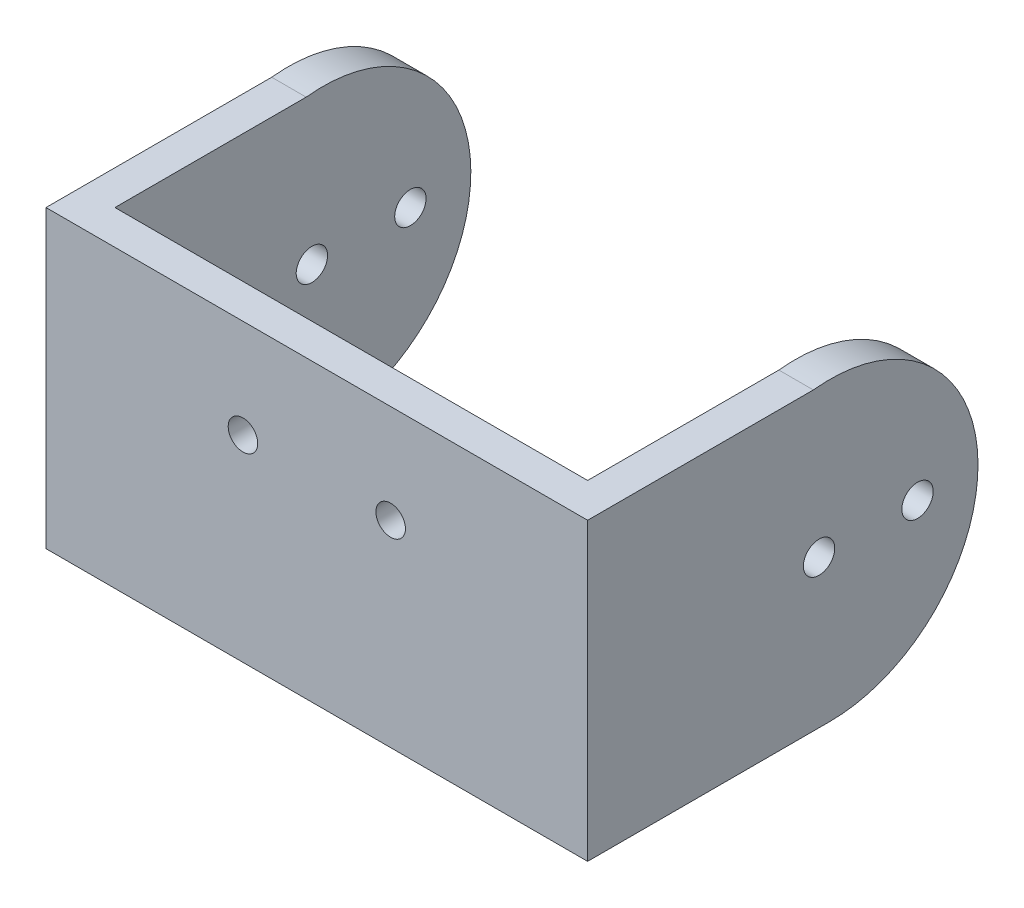
from build123d import *

# Parameters (mm, degrees)
SKETCH_1_W          = 55
SKETCH_1_H          = 30
EXTRUDE_1_DEPTH     = 3.5
SKETCH_2_R          = 1.592723526
EXTRUDE_2_DEPTH     = 3.5
SKETCH_3_R          = 1.5
CUT_EXTRUDE_1_DEPTH = 51.550726744


with BuildPart() as part:
    # 草图1 → 凸台-拉伸1 (new body)
    with BuildSketch(Plane.XY):
        Rectangle(SKETCH_1_W, SKETCH_1_H)
    extrude(amount=EXTRUDE_1_DEPTH)

    # 草图2 → 凸台-拉伸2 (add)
    with BuildSketch(Plane(origin=(27.5, 0, 0), x_dir=(0, 0, -1), z_dir=(1, 0, 0))):
        with BuildLine():
            Line((0, 15), (0, -15))
            Line((0, -15), (21, -15))
            ThreePointArc((21, -15), (36.119015722, 0.838004237), (19.419767517, 15))
            Line((19.419767517, 15), (0, 15))
        make_face()
        with Locations((20, 0)):
            Circle(SKETCH_2_R, mode=Mode.SUBTRACT)
        with Locations((30, 0)):
            Circle(SKETCH_2_R, mode=Mode.SUBTRACT)
    extrude_2 = extrude(amount=-EXTRUDE_2_DEPTH)

    # 镜向1: 凸台-拉伸2 across plane
    add(extrude_2.mirror(Plane(origin=(0, 0, 0), x_dir=(0, 0, 1), z_dir=(1, 0, 0))))

    # 草图3 → 切除-拉伸1 (cut, through all)
    with BuildSketch(Plane.XY.offset(3.5)):
        with Locations((7.5, 5)):
            Circle(SKETCH_3_R)
        with Locations((-7.5, 5)):
            Circle(SKETCH_3_R)
    extrude(amount=-CUT_EXTRUDE_1_DEPTH, mode=Mode.SUBTRACT)


solid = part.part
